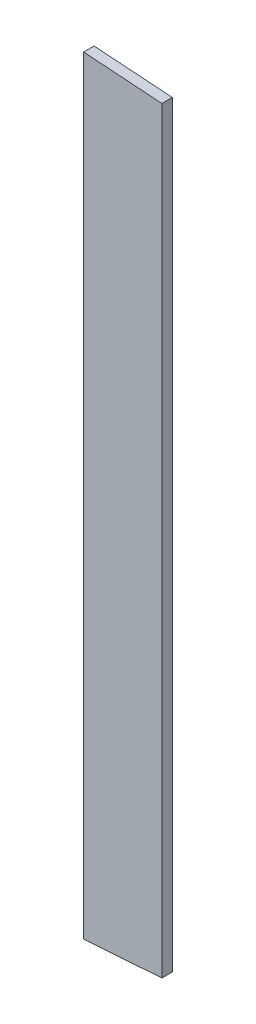
from build123d import *

# Parameters (mm, degrees)
BOSS_EXTRUDE1_DEPTH = 2


with BuildPart() as part:
    # Sketch1 → Boss-Extrude1 (new body)
    with BuildSketch(Plane.XY.offset(1306.099999999)):
        Polygon((-49.769678516, 346.108282384), (-64.769678516, 345.059380205), (-64.769678516, 492.415801833), (-49.769678516, 491.366899654), align=None)
    extrude(amount=BOSS_EXTRUDE1_DEPTH)


solid = part.part
